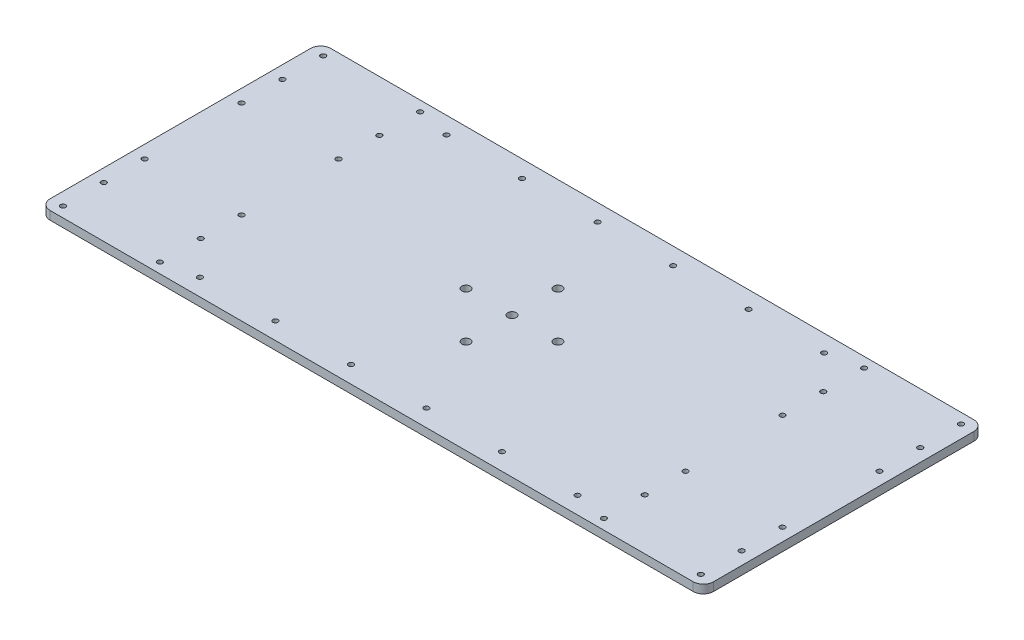
from build123d import *

# Parameters (mm, degrees)
SKETCH1_R           = 1.5
SKETCH1_R_2         = 2.5
BOSS_EXTRUDE1_DEPTH = 5


with BuildPart() as part:
    # Sketch1 → Boss-Extrude1 (new body)
    with BuildSketch(Plane(origin=(0, 0, 0), x_dir=(1, 0, 0), z_dir=(0, 1, 0))):
        with BuildLine():
            Line((-189, -82.5), (189, -82.5))
            ThreePointArc((189, -82.5), (193.242640687, -80.742640687), (195, -76.5))
            Line((195, -76.5), (195, 76.5))
            ThreePointArc((195, 76.5), (193.242640687, 80.742640687), (189, 82.5))
            Line((189, 82.5), (-189, 82.5))
            ThreePointArc((-189, 82.5), (-193.242640687, 80.742640687), (-195, 76.5))
            Line((-195, 76.5), (-195, -76.5))
            ThreePointArc((-195, -76.5), (-193.242640687, -80.742640687), (-189, -82.5))
        make_face()
        with Locations((-187.5, 76.5)):
            Circle(SKETCH1_R, mode=Mode.SUBTRACT)
        with Locations((-187.5, 52.5)):
            Circle(SKETCH1_R, mode=Mode.SUBTRACT)
        with Locations((-187.5, 28.5)):
            Circle(SKETCH1_R, mode=Mode.SUBTRACT)
        with Locations((-130.5, 76.5)):
            Circle(SKETCH1_R, mode=Mode.SUBTRACT)
        with Locations((-130.5, 52.5)):
            Circle(SKETCH1_R, mode=Mode.SUBTRACT)
        with Locations((-130.5, 28.5)):
            Circle(SKETCH1_R, mode=Mode.SUBTRACT)
        with Locations((130.5, 28.5)):
            Circle(SKETCH1_R, mode=Mode.SUBTRACT)
        with Locations((130.5, 52.5)):
            Circle(SKETCH1_R, mode=Mode.SUBTRACT)
        with Locations((130.5, 76.5)):
            Circle(SKETCH1_R, mode=Mode.SUBTRACT)
        with Locations((187.5, 28.5)):
            Circle(SKETCH1_R, mode=Mode.SUBTRACT)
        with Locations((187.5, 52.5)):
            Circle(SKETCH1_R, mode=Mode.SUBTRACT)
        with Locations((187.5, 76.5)):
            Circle(SKETCH1_R, mode=Mode.SUBTRACT)
        with Locations((187.5, -76.5)):
            Circle(SKETCH1_R, mode=Mode.SUBTRACT)
        with Locations((187.5, -52.5)):
            Circle(SKETCH1_R, mode=Mode.SUBTRACT)
        with Locations((187.5, -28.5)):
            Circle(SKETCH1_R, mode=Mode.SUBTRACT)
        with Locations((130.5, -76.5)):
            Circle(SKETCH1_R, mode=Mode.SUBTRACT)
        with Locations((130.5, -52.5)):
            Circle(SKETCH1_R, mode=Mode.SUBTRACT)
        with Locations((130.5, -28.5)):
            Circle(SKETCH1_R, mode=Mode.SUBTRACT)
        with Locations((-130.5, -28.5)):
            Circle(SKETCH1_R, mode=Mode.SUBTRACT)
        with Locations((-130.5, -52.5)):
            Circle(SKETCH1_R, mode=Mode.SUBTRACT)
        with Locations((-130.5, -76.5)):
            Circle(SKETCH1_R, mode=Mode.SUBTRACT)
        with Locations((-187.5, -28.5)):
            Circle(SKETCH1_R, mode=Mode.SUBTRACT)
        with Locations((-187.5, -52.5)):
            Circle(SKETCH1_R, mode=Mode.SUBTRACT)
        with Locations((-187.5, -76.5)):
            Circle(SKETCH1_R, mode=Mode.SUBTRACT)
        with Locations((0, 27)):
            Circle(SKETCH1_R_2, mode=Mode.SUBTRACT)
        with Locations((27, 0)):
            Circle(SKETCH1_R_2, mode=Mode.SUBTRACT)
        with Locations((0, -27)):
            Circle(SKETCH1_R_2, mode=Mode.SUBTRACT)
        with Locations((-27, 0)):
            Circle(SKETCH1_R_2, mode=Mode.SUBTRACT)
        Circle(SKETCH1_R_2, mode=Mode.SUBTRACT)
        with Locations((-111, -72.5)):
            Circle(SKETCH1_R, mode=Mode.SUBTRACT)
        with Locations((-66.6, -72.5)):
            Circle(SKETCH1_R, mode=Mode.SUBTRACT)
        with Locations((-22.2, -72.5)):
            Circle(SKETCH1_R, mode=Mode.SUBTRACT)
        with Locations((22.2, -72.5)):
            Circle(SKETCH1_R, mode=Mode.SUBTRACT)
        with Locations((66.6, -72.5)):
            Circle(SKETCH1_R, mode=Mode.SUBTRACT)
        with Locations((111, -72.5)):
            Circle(SKETCH1_R, mode=Mode.SUBTRACT)
        with Locations((111, 72.5)):
            Circle(SKETCH1_R, mode=Mode.SUBTRACT)
        with Locations((66.6, 72.5)):
            Circle(SKETCH1_R, mode=Mode.SUBTRACT)
        with Locations((22.2, 72.5)):
            Circle(SKETCH1_R, mode=Mode.SUBTRACT)
        with Locations((-22.2, 72.5)):
            Circle(SKETCH1_R, mode=Mode.SUBTRACT)
        with Locations((-66.6, 72.5)):
            Circle(SKETCH1_R, mode=Mode.SUBTRACT)
        with Locations((-111, 72.5)):
            Circle(SKETCH1_R, mode=Mode.SUBTRACT)
    extrude(amount=BOSS_EXTRUDE1_DEPTH)


solid = part.part
